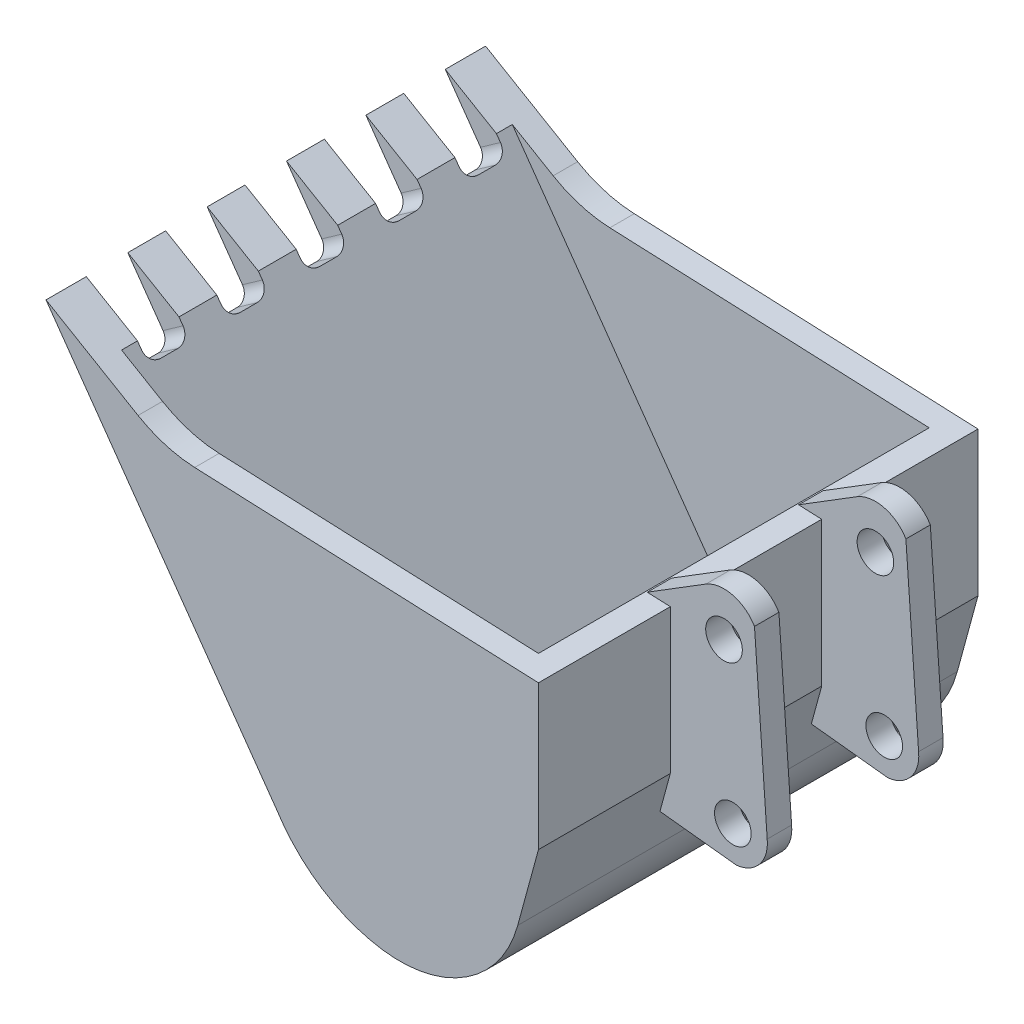
from build123d import *

# Parameters (mm, degrees)
EXTRUDE_1_DEPTH            = 18
EXTRUDE_1_DEPTH_BACK       = 18
SHELL_START                = -16
SHELL_1_DEPTH              = 32
EXTRUDE_START              = 5.2
SKETCH_3_R                 = 1.5
EXTRUDE_4_DEPTH            = 2
SKETCH_4_W                 = 3.4
SKETCH_4_H                 = 6
CUT_EXTRUDE_1_DEPTH        = 10
PATTERN_LINEAR_1_COUNT     = 3
PATTERN_LINEAR_1_PITCH     = 6.5
PATTERN_LINEAR_1_COL_COUNT = 3
PATTERN_LINEAR_1_COL_PITCH = 6.5
FILLET_1_R                 = 1


# Read off the part's stored shape, not the designer's step: 抽壳1
with BuildPart() as part:
    # 草图1 → 凸台-拉伸1 (new, two sides: drawn at the far end of the back side and taken through both)
    with BuildSketch(Plane.XY.offset(-EXTRUDE_1_DEPTH_BACK)):
        with BuildLine():
            Line((151.788918014, 43.508002681), (159.327869649, 39.07926315))
            ThreePointArc((159.327869649, 39.07926315), (161.564024285, 38.110077711), (163.968213283, 37.710599005))
            Line((163.968213283, 37.710599005), (192.119395463, 36.513624191))
            Line((192.119395463, 36.513624191), (192.119395463, 24.680778737))
            Line((192.119395463, 24.680778737), (190.423481116, 18.459832962))
            ThreePointArc((190.423481116, 18.459832962), (186.255085289, 12.72488885), (179.332402452, 11.194669891))
            ThreePointArc((179.332402452, 11.194669891), (174.394698317, 13.051819811), (170.680138106, 16.797746984))
            Line((170.680138106, 16.797746984), (151.788918014, 43.508002681))
        make_face()
    extrude(amount=EXTRUDE_1_DEPTH + EXTRUDE_1_DEPTH_BACK)

    # 抽壳1 outline → 抽壳1 (cut)
    with BuildSketch(Plane.XY.offset(SHELL_START)):
        with BuildLine():
            Line((190.119395463, 24.94850719), (190.119395463, 36.598663235))
            Line((190.119395463, 36.598663235), (163.968213283, 37.710599005))
            ThreePointArc((163.968213283, 37.710599005), (161.564024285, 38.110077711), (159.327869649, 39.07926315))
            Line((159.327869649, 39.07926315), (155.979837332, 41.046056915))
            Line((155.979837332, 41.046056915), (172.342749657, 17.910570164))
            ThreePointArc((172.342749657, 17.910570164), (175.462047648, 14.743395572), (179.621034868, 13.173733136))
            ThreePointArc((179.621034868, 13.173733136), (185.159181138, 14.397908304), (188.493897799, 18.985863593))
            Line((188.493897799, 18.985863593), (190.119395463, 24.94850719))
        make_face()
    extrude(amount=SHELL_1_DEPTH, mode=Mode.SUBTRACT)

    # 草图3 → 凸台-拉伸4 (add)
    with BuildSketch(Plane.XY.offset(EXTRUDE_START)):
        with BuildLine():
            Line((195.035842319, 39.575477762), (190.226405911, 36.594113202))
            Line((190.226405911, 36.594113202), (192.119395463, 36.513624191))
            Line((192.119395463, 36.513624191), (192.119395463, 24.680778737))
            Line((192.119395463, 24.680778737), (191.271438289, 21.570305849))
            Line((191.271438289, 21.570305849), (197.536771011, 20.886144131))
            ThreePointArc((197.536771011, 20.886144131), (199.439234753, 21.918899338), (200.054211557, 23.99441256))
            Line((200.054211557, 23.99441256), (199.013675467, 38.561520293))
            ThreePointArc((199.013675467, 38.561520293), (197.234756361, 39.892335247), (195.035842319, 39.575477762))
        make_face()
        with Locations((197.241357069, 23.698998619)):
            Circle(SKETCH_3_R, mode=Mode.SUBTRACT)
        with Locations((196.517780159, 36.376109938)):
            Circle(SKETCH_3_R, mode=Mode.SUBTRACT)
    extrude_4 = extrude(amount=EXTRUDE_4_DEPTH)

    # 镜向1: 凸台-拉伸4 across plane
    add(extrude_4.mirror(Plane.XY))

    # 草图4 → 切除-拉伸1 (cut)
    with BuildSketch(Plane(origin=(121.688944553, 86.066290803, 0), x_dir=(0, 0, 1), z_dir=(-0.8164358107895011, -0.577436201549998, 0))):
        with Locations((0, -55.12692481)):
            Rectangle(SKETCH_4_W, SKETCH_4_H)
    cut_extrude_1 = extrude(amount=-CUT_EXTRUDE_1_DEPTH, mode=Mode.SUBTRACT)

    # 阵列(线性)1: 切除-拉伸1 ×3
    with Locations(*[(0, 0, -i * PATTERN_LINEAR_1_PITCH) for i in range(1, PATTERN_LINEAR_1_COUNT)]):
        add(cut_extrude_1, mode=Mode.SUBTRACT)

    # 阵列(线性)1 col: 切除-拉伸1 ×3
    with Locations(*[(0, 0, i * PATTERN_LINEAR_1_COL_PITCH) for i in range(1, PATTERN_LINEAR_1_COL_COUNT)]):
        add(cut_extrude_1, mode=Mode.SUBTRACT)

    # 圆角1
    fillet_1_edges = [part.edges().sort_by_distance(p)[0] for p in [
        (156.069971034, 39.186824018, -1.7),
        (156.069971034, 39.186824018, 1.7),
        (156.069971034, 39.186824018, 4.8),
        (156.069971034, 39.186824018, 8.2),
        (156.069971034, 39.186824018, 11.3),
        (156.069971034, 39.186824018, 14.7),
        (156.069971034, 39.186824018, -8.2),
        (156.069971034, 39.186824018, -4.8),
        (156.069971034, 39.186824018, -14.7),
        (156.069971034, 39.186824018, -11.3),
    ]]
    fillet(fillet_1_edges, radius=FILLET_1_R)


solid = part.part
